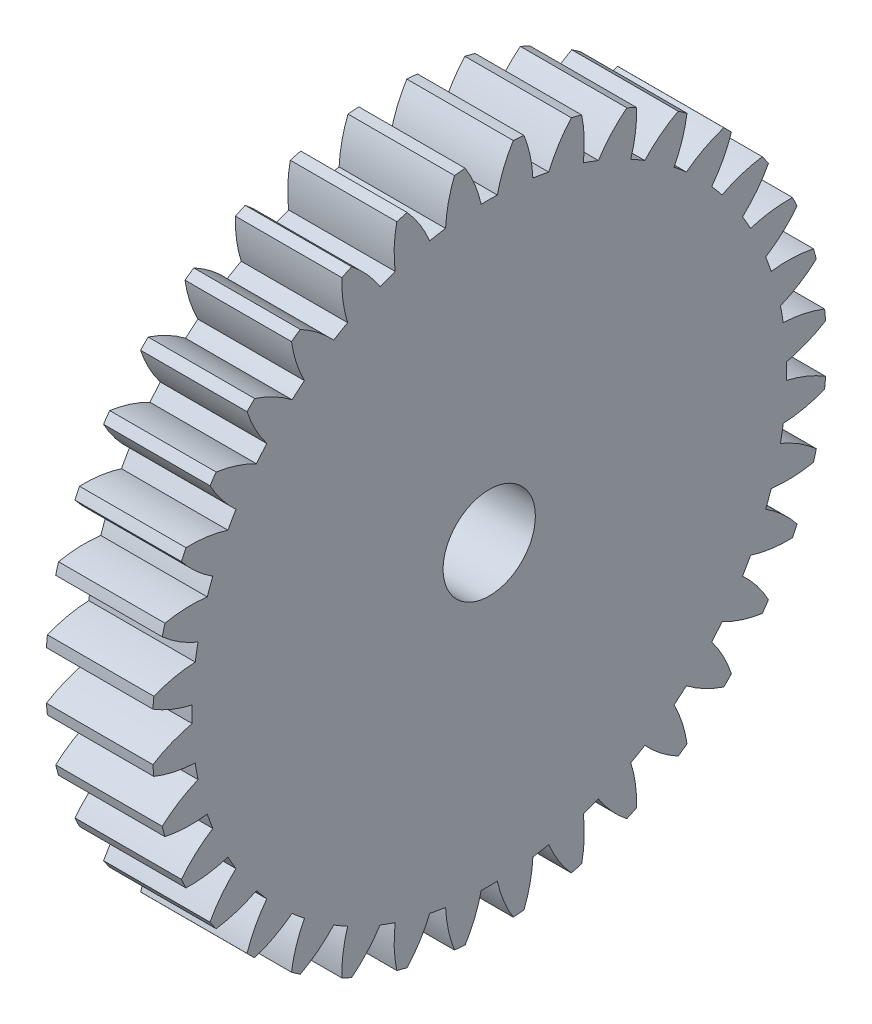
from build123d import *

# Parameters (mm, degrees)
BASPROSKE_W        = 6
BASPROSKE_H        = 19
TOOTHCUT_DEPTH     = 28.531799796
TEETHCUTS_COUNT    = 36
BORSKE_R           = 0.4
BORE_DEPTH         = 50.0000508
SKETCH1_R          = 2.6
CUT_EXTRUDE1_DEPTH = 28.465150249


with BuildPart() as part:
    # BasProSke → Base-Revolve (revolve)
    with BuildSketch(Plane(origin=(0, 0, 0), x_dir=(1, 0, 0), z_dir=(0, 1, 0))):
        with Locations((3, 9.5)):
            Rectangle(BASPROSKE_W, BASPROSKE_H)
    revolve(axis=Axis((-10, 0, 0), (1, 0, 0)))

    # TooCutSke → ToothCut (cut, through all)
    with BuildSketch(Plane(origin=(0, 0, 0), x_dir=(0, 0, -1), z_dir=(1, 0, 0))):
        with BuildLine():
            ThreePointArc((0.454664826, 16.742827745), (0, 16.749), (-0.454664826, 16.742827745))
            ThreePointArc((-0.454664826, 16.742827745), (-0.817558311, 17.898033097), (-1.368909141, 18.976088452))
            ThreePointArc((-1.368909141, 18.976088452), (0, 19.0254), (1.368909141, 18.976088452))
            ThreePointArc((1.368909141, 18.976088452), (0.817558311, 17.898033097), (0.454664826, 16.742827745))
        make_face()
    toothcut = extrude(amount=TOOTHCUT_DEPTH, mode=Mode.SUBTRACT)

    # TeethCuts: ToothCut ×36 about axis
    teethcuts_axis = Axis((-10, 0, 0), (1, 0, 0))
    for i in range(1, TEETHCUTS_COUNT):
        add(toothcut.rotate(teethcuts_axis, i * 360 / TEETHCUTS_COUNT), mode=Mode.SUBTRACT)

    # BorSke → Bore (cut, symmetric)
    with BuildSketch(Plane(origin=(0, 0, 0), x_dir=(0, 0, -1), z_dir=(1, 0, 0))):
        Circle(BORSKE_R)
    extrude(amount=BORE_DEPTH, both=True, mode=Mode.SUBTRACT)

    # Sketch1 → Cut-Extrude1 (cut, through all)
    with BuildSketch(Plane(origin=(6, 0, 0), x_dir=(0, 0, -1), z_dir=(1, 0, 0))):
        Circle(SKETCH1_R)
    extrude(amount=-CUT_EXTRUDE1_DEPTH, mode=Mode.SUBTRACT)


solid = part.part
